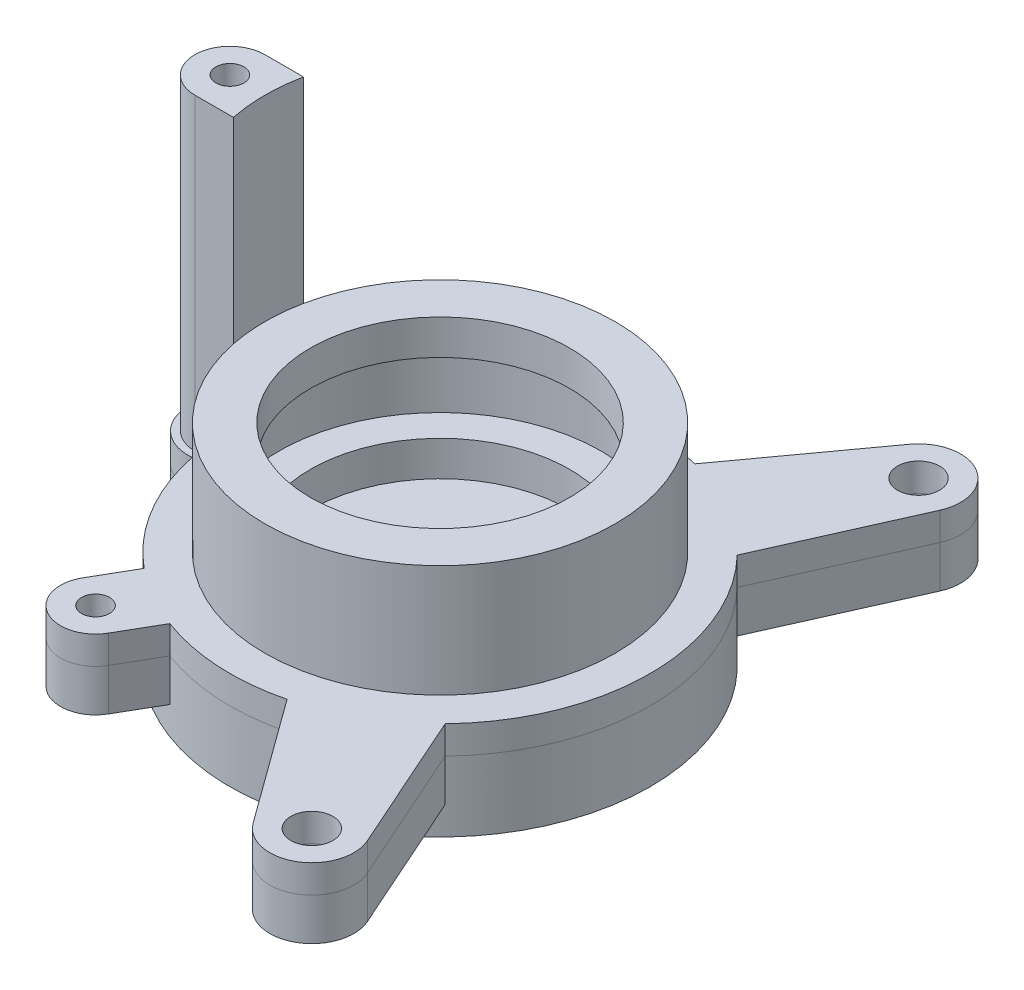
from build123d import *

# Parameters (mm, degrees)
SKETCH1_R                = 12.5
SKETCH1_R_2              = 9.25
BOSS_EXTRUDE1_DEPTH      = 10
CUT_EXTRUDE1_START       = -5
SKETCH2_R                = 11.5
SKETCH2_R_2              = 9.25
CUT_EXTRUDE1_DEPTH       = 5
BOSS_EXTRUDE2_DEPTH      = 5
BOSS_EXTRUDE2_DEPTH_BACK = 2
SKETCH4_R                = 1
BOSS_EXTRUDE4_DEPTH      = 22
CUT_EXTRUDE8_START       = -2
SKETCH4_3_R              = 1
CUT_EXTRUDE8_DEPTH       = 2
ARMS_START               = -3
SKETCH5_R                = 1
SKETCH5_R_2              = 1.5
ARMS_DEPTH               = 5
SKETCH7_R                = 1.6
SKETCH7_R_2              = 2.1
CUT_EXTRUDE4_DEPTH       = 4
CUT_EXTRUDE6_DEPTH       = 3
CUT_EXTRUDE7_START       = -2
SKETCH10_R               = 9.25
CUT_EXTRUDE7_DEPTH       = 2


with BuildPart() as part:
    # Sketch1 → Boss-Extrude1 (new body)
    with BuildSketch(Plane(origin=(0, 0, 0), x_dir=(1, 0, 0), z_dir=(0, 1, 0))):
        Circle(SKETCH1_R)
        Circle(SKETCH1_R_2, mode=Mode.SUBTRACT)
    extrude(amount=BOSS_EXTRUDE1_DEPTH)

    # Sketch2 → Cut-Extrude1 (cut)
    with BuildSketch(Plane(origin=(0, 7.5, 0), x_dir=(1, 0, 0), z_dir=(0, 1, 0)).offset(CUT_EXTRUDE1_START)):
        Circle(SKETCH2_R)
        Circle(SKETCH2_R_2, mode=Mode.SUBTRACT)
    extrude(amount=CUT_EXTRUDE1_DEPTH, mode=Mode.SUBTRACT)

    # Sketch3 → Boss-Extrude2 (add, two sides: drawn at the far end of the back side and taken through both)
    with BuildSketch(Plane.XZ.offset(-BOSS_EXTRUDE2_DEPTH_BACK)):
        with BuildLine():
            ThreePointArc((-14.7, 2.984962311), (-18, 0), (-14.7, -2.984962311))
            ThreePointArc((-14.7, -2.984962311), (15, 0), (-14.7, 2.984962311))
        make_face()
    extrude(amount=BOSS_EXTRUDE2_DEPTH + BOSS_EXTRUDE2_DEPTH_BACK)

    # Sketch4 → Boss-Extrude4 (add)
    with BuildSketch(Plane(origin=(0, 2, 0), x_dir=(1, 0, 0), z_dir=(0, 1, 0))):
        with BuildLine():
            Line((-12.247448714, 2.5), (-15, 2.5))
            ThreePointArc((-15, 2.5), (-17.5, 0), (-15, -2.5))
            Line((-15, -2.5), (-12.247448714, -2.5))
            ThreePointArc((-12.247448714, -2.5), (-12.5, 0), (-12.247448714, 2.5))
        make_face()
        with Locations((-15, 0)):
            Circle(SKETCH4_R, mode=Mode.SUBTRACT)
    extrude(amount=BOSS_EXTRUDE4_DEPTH)

    # Sketch4<3> → Cut-Extrude8 (cut)
    with BuildSketch(Plane(origin=(0, 2, 0), x_dir=(1, 0, 0), z_dir=(0, 1, 0)).offset(CUT_EXTRUDE8_START)):
        with Locations((-15, 0)):
            Circle(SKETCH4_3_R)
    extrude(amount=CUT_EXTRUDE8_DEPTH, mode=Mode.SUBTRACT)

    # Sketch5 → ARMS (add)
    # profile 1 of 2: a face of its own
    with BuildSketch(Plane(origin=(0, 0, 0), x_dir=(1, 0, 0), z_dir=(0, 1, 0)).offset(ARMS_START)):
        with BuildLine():
            Line((-3.958660847, 11.856601718), (-6.834936491, 16.838457268))
            ThreePointArc((-6.834936491, 16.838457268), (-10.25, 17.753520778), (-11.165063509, 14.338457268))
            Line((-11.165063509, 14.338457268), (-8.288787866, 9.356601718))
            ThreePointArc((-8.288787866, 9.356601718), (-6.25, 10.825317547), (-3.958660847, 11.856601718))
        make_face()
        with Locations((-9, 15.588457268)):
            Circle(SKETCH5_R, mode=Mode.SUBTRACT)
    # profile 2 of 2: a face of its own
    with BuildSketch(Plane(origin=(0, 0, 0), x_dir=(1, 0, 0), z_dir=(0, 1, 0)).offset(ARMS_START)):
        with BuildLine():
            Line((9.670679834, 7.92009795), (15.240636373, 20.430425165))
            ThreePointArc((15.240636373, 20.430425165), (14, 24.248711306), (10.072949017, 23.413990851))
            Line((10.072949017, 23.413990851), (2.023666108, 12.335103384))
            Line((2.023666108, 12.335103384), (9.670679834, 7.92009795))
        make_face()
        with Locations((12.5, 21.650635095)):
            Circle(SKETCH5_R_2, mode=Mode.SUBTRACT)
    arms = extrude(amount=ARMS_DEPTH)

    # Sketch7 → Cut-Extrude4 (cut)
    with BuildSketch(Plane.XZ.offset(5)):
        with Locations((-9, -15.588457268)):
            Circle(SKETCH7_R)
        with Locations((12.5, -21.650635095)):
            Circle(SKETCH7_R_2)
    cut_extrude4 = extrude(amount=-CUT_EXTRUDE4_DEPTH, mode=Mode.SUBTRACT)

    # Mirror1: ARMS, Cut-Extrude4 across plane
    add(arms.mirror(Plane.XY))
    add(cut_extrude4.mirror(Plane.XY), mode=Mode.SUBTRACT)

    # Sketch9 → Cut-Extrude6 (cut)
    with BuildSketch(Plane(origin=(0, 0, 0), x_dir=(1, 0, 0), z_dir=(0, 1, 0))):
        with BuildLine():
            ThreePointArc((-13.671875, -3.013276287), (14, 0), (-13.671875, 3.013276287))
            ThreePointArc((-13.671875, 3.013276287), (-14.237475869, 2.00333578), (-15.267857143, 1.475890426))
            ThreePointArc((-15.267857143, 1.475890426), (-16.5, 0), (-15.267857143, -1.475890426))
            ThreePointArc((-15.267857143, -1.475890426), (-14.237475869, -2.00333578), (-13.671875, -3.013276287))
        make_face()
    extrude(amount=-CUT_EXTRUDE6_DEPTH, mode=Mode.SUBTRACT)

    # Sketch10 → Cut-Extrude7 (cut)
    with BuildSketch(Plane(origin=(0, 2, 0), x_dir=(1, 0, 0), z_dir=(0, 1, 0)).offset(CUT_EXTRUDE7_START)):
        Circle(SKETCH10_R)
    extrude(amount=CUT_EXTRUDE7_DEPTH, mode=Mode.SUBTRACT)


with BuildPart() as body_2:
    # Split1: the piece on the far side of the plane
    add(part.part)
    split(bisect_by=Plane.ZX, keep=Keep.BOTTOM)


with BuildPart() as part_1:
    add(part.part)

    # Split1
    split(bisect_by=Plane.ZX, keep=Keep.TOP)


solid = Compound([body_2.part, part_1.part])
